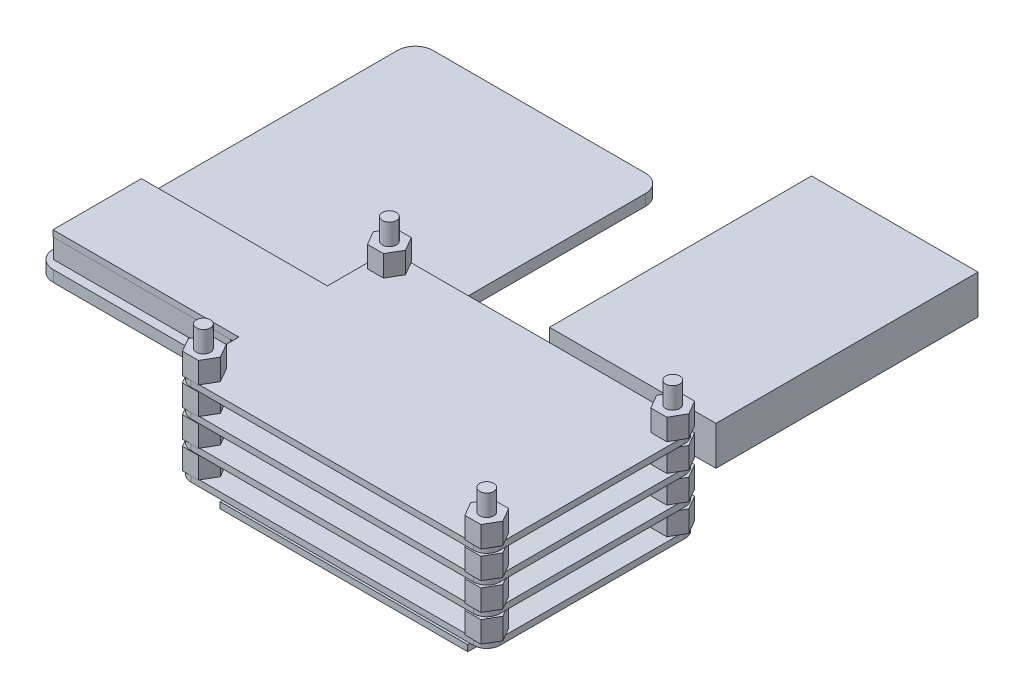
from build123d import *

# Parameters (mm, degrees)
SKETCH1_W             = 44.323
SKETCH1_H             = 30.353
SKETCH1_R             = 1.0033
BOSS_EXTRUDE1_DEPTH   = 0.889
FILLET1_R             = 1.905
BOSS_EXTRUDE2_DEPTH   = 3.048
SKETCH3_W             = 16.51
SKETCH3_H             = 2.54
BOSS_EXTRUDE3_DEPTH   = 3.048
LPATTERN4_START       = -3.937
LPATTERN4_OUTLINE_R   = 1.0033
LPATTERN4_DEPTH       = 0.889
LPATTERN4_START_2     = -3.048
LPATTERN4_2_DEPTH     = 3.048
LPATTERN4_START_3     = -6.985
LPATTERN4_3_OUTLINE_W = 16.51
LPATTERN4_3_OUTLINE_H = 2.54
LPATTERN4_3_DEPTH     = 3.048
LPATTERN5_START       = -11.811
LPATTERN5_OUTLINE_R   = 1.0033
LPATTERN5_DEPTH       = 0.889
LPATTERN5_START_2     = -7.874
LPATTERN5_2_OUTLINE_R = 1.0033
LPATTERN5_2_DEPTH     = 0.889
LPATTERN5_START_3     = -10.922
LPATTERN5_3_OUTLINE_R = 1.0033
LPATTERN5_3_OUTLINE_W = 16.51
LPATTERN5_3_OUTLINE_H = 2.54
LPATTERN5_3_DEPTH     = 6.985
LPATTERN5_START_4     = -14.859
LPATTERN5_4_OUTLINE_W = 16.51
LPATTERN5_4_OUTLINE_H = 2.54
LPATTERN5_4_DEPTH     = 3.048
LPATTERN5_5_OUTLINE_R = 1.0033
LPATTERN5_5_DEPTH     = 3.048
LPATTERN5_START_5     = -6.985
LPATTERN5_6_OUTLINE_R = 1.0033
LPATTERN5_6_DEPTH     = 3.048
SKETCH5_W             = 35.5219
SKETCH5_H             = 24.9682
SKETCH5_R             = 1.0033
BOSS_EXTRUDE4_DEPTH   = 0.889
BOSS_EXTRUDE5_REACH   = 35.239
SKETCH7_W             = 27.686
SKETCH7_H             = 18.542
BOSS_EXTRUDE6_DEPTH   = 1.27
SKETCH8_W             = 26.67
SKETCH8_H             = 12.7
BOSS_EXTRUDE7_DEPTH   = 0.889
SKETCH9_R             = 1.0033
BOSS_EXTRUDE8_DEPTH   = 3.048
SKETCH10_W            = 25.4
SKETCH10_H            = 2.54
BOSS_EXTRUDE9_DEPTH   = 2.794
BOSS_EXTRUDE10_DEPTH  = 1.6002
SKETCH13_R            = 0.635
BOSS_EXTRUDE11_DEPTH  = 2.54
SKETCH14_W            = 23.876
SKETCH14_H            = 5.588
BOSS_EXTRUDE12_DEPTH  = 37.592


# Read off the part's stored shape, not the designer's step: LPattern4, LPattern5
with BuildPart() as part:
    # Sketch1 → Boss-Extrude1 (new body)
    with BuildSketch(Plane(origin=(0, 0, 0), x_dir=(1, 0, 0), z_dir=(0, 1, 0))):
        Rectangle(SKETCH1_W, SKETCH1_H)
        with Locations(Location((-20.2565, 13.2715, 0), (0, 0, 270))):
            Circle(SKETCH1_R, mode=Mode.SUBTRACT)
        with Locations(Location((20.3835, 13.2715, 0), (0, 0, 270))):
            Circle(SKETCH1_R, mode=Mode.SUBTRACT)
        with Locations(Location((20.3835, -13.3985, 0), (0, 0, 270))):
            Circle(SKETCH1_R, mode=Mode.SUBTRACT)
        with Locations(Location((-20.2565, -13.3985, 0), (0, 0, 270))):
            Circle(SKETCH1_R, mode=Mode.SUBTRACT)
    extrude(amount=BOSS_EXTRUDE1_DEPTH)

    # Fillet1
    fillet1_edges = [part.edges().sort_by_distance(p)[0] for p in [
        (22.1615, 0.4445, 15.1765),
        (-22.1615, 0.4445, 15.1765),
        (-22.1615, 0.4445, -15.1765),
        (22.1615, 0.4445, -15.1765),
    ]]
    fillet(fillet1_edges, radius=FILLET1_R)

    # Sketch2 → Boss-Extrude2 (add)
    with BuildSketch(Plane(origin=(0, 0.889, 0), x_dir=(1, 0, 0), z_dir=(0, 1, 0))):
        Polygon((18.081142597, 13.2715), (19.232321298, 11.2776), (21.534678702, 11.2776), (22.685857403, 13.2715), (21.534678702, 15.2654), (19.232321298, 15.2654), align=None)
        Polygon((18.081142597, -13.3985), (19.232321298, -15.3924), (21.534678702, -15.3924), (22.685857403, -13.3985), (21.534678702, -11.4046), (19.232321298, -11.4046), align=None)
        Polygon((-17.954163663, -13.281349176), (-19.096802195, -11.282542833), (-21.399138532, -11.272693656), (-22.558836337, -13.261650824), (-21.416197805, -15.260457167), (-19.113861468, -15.270306344), align=None)
        Polygon((-17.954144347, 13.27433901), (-19.107780828, 15.266817989), (-21.410136481, 15.263978979), (-22.558855653, 13.26866099), (-21.405219172, 11.276182011), (-19.102863519, 11.279021021), align=None)
    extrude(amount=BOSS_EXTRUDE2_DEPTH)

    # Sketch3 → Boss-Extrude3 (add)
    with BuildSketch(Plane(origin=(0, 0, 0), x_dir=(-1, 0, 0), z_dir=(0, -1, 0))):
        with Locations((5.9563, -9.2202)):
            Rectangle(SKETCH3_W, SKETCH3_H)
    extrude(amount=BOSS_EXTRUDE3_DEPTH)

    # LPattern4 outline → LPattern4 (add)
    with BuildSketch(Plane(origin=(0, 0, 0), x_dir=(1, 0, 0), z_dir=(0, 1, 0)).offset(LPATTERN4_START)):
        with BuildLine():
            ThreePointArc((22.1615, 13.2715), (21.603538418, 14.618538418), (20.2565, 15.1765))
            Line((20.2565, 15.1765), (-20.2565, 15.1765))
            ThreePointArc((-20.2565, 15.1765), (-21.603538418, 14.618538418), (-22.1615, 13.2715))
            Line((-22.1615, 13.2715), (-22.1615, -13.2715))
            ThreePointArc((-22.1615, -13.2715), (-21.603538418, -14.618538418), (-20.2565, -15.1765))
            Line((-20.2565, -15.1765), (20.2565, -15.1765))
            ThreePointArc((20.2565, -15.1765), (21.603538418, -14.618538418), (22.1615, -13.2715))
            Line((22.1615, -13.2715), (22.1615, 13.2715))
        make_face()
        with Locations((20.3835, 13.2715)):
            Circle(LPATTERN4_OUTLINE_R, mode=Mode.SUBTRACT)
        with Locations((20.3835, -13.3985)):
            Circle(LPATTERN4_OUTLINE_R, mode=Mode.SUBTRACT)
        with Locations((-20.2565, -13.3985)):
            Circle(LPATTERN4_OUTLINE_R, mode=Mode.SUBTRACT)
        with Locations((-20.2565, 13.2715)):
            Circle(LPATTERN4_OUTLINE_R, mode=Mode.SUBTRACT)
    extrude(amount=LPATTERN4_DEPTH)

    # LPattern4 2 outline → LPattern4 2 (add)
    with BuildSketch(Plane(origin=(0, 0, 0), x_dir=(1, 0, 0), z_dir=(0, 1, 0)).offset(LPATTERN4_START_2)):
        Polygon((19.232321298, 15.2654), (18.081142597, 13.2715), (19.232321298, 11.2776), (21.534678702, 11.2776), (22.685857403, 13.2715), (21.534678702, 15.2654), align=None)
        Polygon((22.685857403, -13.3985), (21.534678702, -11.4046), (19.232321298, -11.4046), (18.081142597, -13.3985), (19.232321298, -15.3924), (21.534678702, -15.3924), align=None)
        Polygon((-17.954144347, 13.27433901), (-19.107780828, 15.266817989), (-21.410136481, 15.263978979), (-22.558855653, 13.26866099), (-21.405219172, 11.276182011), (-19.102863519, 11.279021021), align=None)
        Polygon((-19.113861468, -15.270306344), (-17.954163663, -13.281349176), (-19.096802195, -11.282542833), (-21.399138532, -11.272693656), (-22.558836337, -13.261650824), (-21.416197805, -15.260457167), align=None)
    extrude(amount=LPATTERN4_2_DEPTH)

    # LPattern4 3 outline → LPattern4 3 (add)
    with BuildSketch(Plane(origin=(0, 0, 0), x_dir=(1, 0, 0), z_dir=(0, 1, 0)).offset(LPATTERN4_START_3)):
        with Locations((-5.9563, -9.2202)):
            Rectangle(LPATTERN4_3_OUTLINE_W, LPATTERN4_3_OUTLINE_H)
    extrude(amount=LPATTERN4_3_DEPTH)

    # LPattern5 2 outline → LPattern5 2 (add)
    with BuildSketch(Plane(origin=(0, 0, 0), x_dir=(1, 0, 0), z_dir=(0, 1, 0)).offset(LPATTERN5_START_2)):
        with BuildLine():
            ThreePointArc((22.1615, 13.2715), (21.603538418, 14.618538418), (20.2565, 15.1765))
            Line((20.2565, 15.1765), (-20.2565, 15.1765))
            ThreePointArc((-20.2565, 15.1765), (-21.603538418, 14.618538418), (-22.1615, 13.2715))
            Line((-22.1615, 13.2715), (-22.1615, -13.2715))
            ThreePointArc((-22.1615, -13.2715), (-21.603538418, -14.618538418), (-20.2565, -15.1765))
            Line((-20.2565, -15.1765), (20.2565, -15.1765))
            ThreePointArc((20.2565, -15.1765), (21.603538418, -14.618538418), (22.1615, -13.2715))
            Line((22.1615, -13.2715), (22.1615, 13.2715))
        make_face()
        with Locations((20.3835, 13.2715)):
            Circle(LPATTERN5_2_OUTLINE_R, mode=Mode.SUBTRACT)
        with Locations((20.3835, -13.3985)):
            Circle(LPATTERN5_2_OUTLINE_R, mode=Mode.SUBTRACT)
        with Locations((-20.2565, -13.3985)):
            Circle(LPATTERN5_2_OUTLINE_R, mode=Mode.SUBTRACT)
        with Locations((-20.2565, 13.2715)):
            Circle(LPATTERN5_2_OUTLINE_R, mode=Mode.SUBTRACT)
    extrude(amount=LPATTERN5_2_DEPTH)



with BuildPart() as body_2:
    # LPattern5 outline → LPattern5 (new body)
    with BuildSketch(Plane(origin=(0, 0, 0), x_dir=(1, 0, 0), z_dir=(0, 1, 0)).offset(LPATTERN5_START)):
        with BuildLine():
            ThreePointArc((22.1615, 13.2715), (21.603538418, 14.618538418), (20.2565, 15.1765))
            Line((20.2565, 15.1765), (-20.2565, 15.1765))
            ThreePointArc((-20.2565, 15.1765), (-21.603538418, 14.618538418), (-22.1615, 13.2715))
            Line((-22.1615, 13.2715), (-22.1615, -13.2715))
            ThreePointArc((-22.1615, -13.2715), (-21.603538418, -14.618538418), (-20.2565, -15.1765))
            Line((-20.2565, -15.1765), (20.2565, -15.1765))
            ThreePointArc((20.2565, -15.1765), (21.603538418, -14.618538418), (22.1615, -13.2715))
            Line((22.1615, -13.2715), (22.1615, 13.2715))
        make_face()
        with Locations((20.3835, 13.2715)):
            Circle(LPATTERN5_OUTLINE_R, mode=Mode.SUBTRACT)
        with Locations((20.3835, -13.3985)):
            Circle(LPATTERN5_OUTLINE_R, mode=Mode.SUBTRACT)
        with Locations((-20.2565, -13.3985)):
            Circle(LPATTERN5_OUTLINE_R, mode=Mode.SUBTRACT)
        with Locations((-20.2565, 13.2715)):
            Circle(LPATTERN5_OUTLINE_R, mode=Mode.SUBTRACT)
    extrude(amount=LPATTERN5_DEPTH)


with BuildPart() as part_1:
    add(part.part)

    add(body_2.part)  # LPattern5 3 merges body 2
    # LPattern5 3 outline → LPattern5 3 (add)
    # profile 1 of 5: a face of its own
    with BuildSketch(Plane(origin=(0, 0, 0), x_dir=(1, 0, 0), z_dir=(0, 1, 0)).offset(LPATTERN5_START_3)):
        with BuildLine():
            Line((22.1615, 12.363286336), (22.1615, 13.2715))
            ThreePointArc((22.1615, 13.2715), (21.603538418, 14.618538418), (20.2565, 15.1765))
            Line((20.2565, 15.1765), (19.180994859, 15.1765))
            Line((19.180994859, 15.1765), (18.081142597, 13.2715))
            Line((18.081142597, 13.2715), (19.232321298, 11.2776))
            Line((19.232321298, 11.2776), (21.534678702, 11.2776))
            Line((21.534678702, 11.2776), (22.1615, 12.363286336))
        make_face()
        with Locations((20.3835, 13.2715)):
            Circle(LPATTERN5_3_OUTLINE_R, mode=Mode.SUBTRACT)
    # profile 2 of 5: a face of its own
    with BuildSketch(Plane(origin=(0, 0, 0), x_dir=(1, 0, 0), z_dir=(0, 1, 0)).offset(LPATTERN5_START_3)):
        with BuildLine():
            Line((22.1615, -13.2715), (22.1615, -12.490286336))
            Line((22.1615, -12.490286336), (21.534678702, -11.4046))
            Line((21.534678702, -11.4046), (19.232321298, -11.4046))
            Line((19.232321298, -11.4046), (18.081142597, -13.3985))
            Line((18.081142597, -13.3985), (19.107671375, -15.1765))
            Line((19.107671375, -15.1765), (20.2565, -15.1765))
            ThreePointArc((20.2565, -15.1765), (21.603538418, -14.618538418), (22.1615, -13.2715))
        make_face()
        with Locations((20.3835, -13.3985)):
            Circle(LPATTERN5_3_OUTLINE_R, mode=Mode.SUBTRACT)
    # profile 3 of 5: a face of its own
    with BuildSketch(Plane(origin=(0, 0, 0), x_dir=(1, 0, 0), z_dir=(0, 1, 0)).offset(LPATTERN5_START_3)):
        with BuildLine():
            Line((-17.954144347, 13.27433901), (-19.055487113, 15.1765))
            Line((-19.055487113, 15.1765), (-20.2565, 15.1765))
            ThreePointArc((-20.2565, 15.1765), (-21.603538418, 14.618538418), (-22.1615, 13.2715))
            Line((-22.1615, 13.2715), (-22.1615, 12.582376533))
            Line((-22.1615, 12.582376533), (-21.405219172, 11.276182011))
            Line((-21.405219172, 11.276182011), (-19.102863519, 11.279021021))
            Line((-19.102863519, 11.279021021), (-17.954144347, 13.27433901))
        make_face()
        with Locations((-20.2565, 13.2715)):
            Circle(LPATTERN5_3_OUTLINE_R, mode=Mode.SUBTRACT)
    # profile 4 of 5: a face of its own
    with BuildSketch(Plane(origin=(0, 0, 0), x_dir=(1, 0, 0), z_dir=(0, 1, 0)).offset(LPATTERN5_START_3)):
        with BuildLine():
            Line((-20.2565, -15.1765), (-19.059165966, -15.1765))
            Line((-19.059165966, -15.1765), (-17.954163663, -13.281349176))
            Line((-17.954163663, -13.281349176), (-19.096802195, -11.282542833))
            Line((-19.096802195, -11.282542833), (-21.399138532, -11.272693656))
            Line((-21.399138532, -11.272693656), (-22.1615, -12.580193161))
            Line((-22.1615, -12.580193161), (-22.1615, -13.2715))
            ThreePointArc((-22.1615, -13.2715), (-21.603538418, -14.618538418), (-20.2565, -15.1765))
        make_face()
        with Locations((-20.2565, -13.3985)):
            Circle(LPATTERN5_3_OUTLINE_R, mode=Mode.SUBTRACT)
    # profile 5 of 5: a face of its own
    with BuildSketch(Plane(origin=(0, 0, 0), x_dir=(1, 0, 0), z_dir=(0, 1, 0)).offset(LPATTERN5_START_3)):
        with Locations((-5.9563, -9.2202)):
            Rectangle(LPATTERN5_3_OUTLINE_W, LPATTERN5_3_OUTLINE_H)
    extrude(amount=LPATTERN5_3_DEPTH)

    # LPattern5 4 outline → LPattern5 4 (add)
    with BuildSketch(Plane(origin=(0, 0, 0), x_dir=(1, 0, 0), z_dir=(0, 1, 0)).offset(LPATTERN5_START_4)):
        with Locations((-5.9563, -9.2202)):
            Rectangle(LPATTERN5_4_OUTLINE_W, LPATTERN5_4_OUTLINE_H)
    extrude(amount=LPATTERN5_4_DEPTH)

    # LPattern5 5 outline → LPattern5 5 (add)
    with BuildSketch(Plane(origin=(0, 0, 0), x_dir=(1, 0, 0), z_dir=(0, 1, 0)).offset(LPATTERN5_START_3)):
        with BuildLine():
            ThreePointArc((20.2565, 15.1765), (21.603538418, 14.618538418), (22.1615, 13.2715))
            Line((22.1615, 13.2715), (22.1615, 12.363286336))
            Line((22.1615, 12.363286336), (22.685857403, 13.2715))
            Line((22.685857403, 13.2715), (21.534678702, 15.2654))
            Line((21.534678702, 15.2654), (19.232321298, 15.2654))
            Line((19.232321298, 15.2654), (19.180994859, 15.1765))
            Line((19.180994859, 15.1765), (20.2565, 15.1765))
        make_face()
        with BuildLine():
            Line((22.685857403, -13.3985), (22.1615, -12.490286336))
            Line((22.1615, -12.490286336), (22.1615, -13.2715))
            ThreePointArc((22.1615, -13.2715), (21.603538418, -14.618538418), (20.2565, -15.1765))
            Line((20.2565, -15.1765), (19.107671375, -15.1765))
            Line((19.107671375, -15.1765), (19.232321298, -15.3924))
            Line((19.232321298, -15.3924), (21.534678702, -15.3924))
            Line((21.534678702, -15.3924), (22.685857403, -13.3985))
        make_face()
        with BuildLine():
            Line((-20.2565, 15.1765), (-19.055487113, 15.1765))
            Line((-19.055487113, 15.1765), (-19.107780828, 15.266817989))
            Line((-19.107780828, 15.266817989), (-21.410136481, 15.263978979))
            Line((-21.410136481, 15.263978979), (-22.558855653, 13.26866099))
            Line((-22.558855653, 13.26866099), (-22.1615, 12.582376533))
            Line((-22.1615, 12.582376533), (-22.1615, 13.2715))
            ThreePointArc((-22.1615, 13.2715), (-21.603538418, 14.618538418), (-20.2565, 15.1765))
        make_face()
        with BuildLine():
            Line((-19.113861468, -15.270306344), (-19.059165966, -15.1765))
            Line((-19.059165966, -15.1765), (-20.2565, -15.1765))
            ThreePointArc((-20.2565, -15.1765), (-21.603538418, -14.618538418), (-22.1615, -13.2715))
            Line((-22.1615, -13.2715), (-22.1615, -12.580193161))
            Line((-22.1615, -12.580193161), (-22.558836337, -13.261650824))
            Line((-22.558836337, -13.261650824), (-21.416197805, -15.260457167))
            Line((-21.416197805, -15.260457167), (-19.113861468, -15.270306344))
        make_face()
        with Locations((-20.2565, 13.2715)):
            Circle(LPATTERN5_5_OUTLINE_R)
        with Locations((20.3835, 13.2715)):
            Circle(LPATTERN5_5_OUTLINE_R)
        with Locations((20.3835, -13.3985)):
            Circle(LPATTERN5_5_OUTLINE_R)
        with Locations((-20.2565, -13.3985)):
            Circle(LPATTERN5_5_OUTLINE_R)
    extrude(amount=LPATTERN5_5_DEPTH)

    # LPattern5 6 outline → LPattern5 6 (add)
    with BuildSketch(Plane(origin=(0, 0, 0), x_dir=(1, 0, 0), z_dir=(0, 1, 0)).offset(LPATTERN5_START_5)):
        with BuildLine():
            ThreePointArc((20.2565, 15.1765), (21.603538418, 14.618538418), (22.1615, 13.2715))
            Line((22.1615, 13.2715), (22.1615, 12.363286336))
            Line((22.1615, 12.363286336), (22.685857403, 13.2715))
            Line((22.685857403, 13.2715), (21.534678702, 15.2654))
            Line((21.534678702, 15.2654), (19.232321298, 15.2654))
            Line((19.232321298, 15.2654), (19.180994859, 15.1765))
            Line((19.180994859, 15.1765), (20.2565, 15.1765))
        make_face()
        with BuildLine():
            Line((22.685857403, -13.3985), (22.1615, -12.490286336))
            Line((22.1615, -12.490286336), (22.1615, -13.2715))
            ThreePointArc((22.1615, -13.2715), (21.603538418, -14.618538418), (20.2565, -15.1765))
            Line((20.2565, -15.1765), (19.107671375, -15.1765))
            Line((19.107671375, -15.1765), (19.232321298, -15.3924))
            Line((19.232321298, -15.3924), (21.534678702, -15.3924))
            Line((21.534678702, -15.3924), (22.685857403, -13.3985))
        make_face()
        with BuildLine():
            Line((-20.2565, 15.1765), (-19.055487113, 15.1765))
            Line((-19.055487113, 15.1765), (-19.107780828, 15.266817989))
            Line((-19.107780828, 15.266817989), (-21.410136481, 15.263978979))
            Line((-21.410136481, 15.263978979), (-22.558855653, 13.26866099))
            Line((-22.558855653, 13.26866099), (-22.1615, 12.582376533))
            Line((-22.1615, 12.582376533), (-22.1615, 13.2715))
            ThreePointArc((-22.1615, 13.2715), (-21.603538418, 14.618538418), (-20.2565, 15.1765))
        make_face()
        with BuildLine():
            Line((-19.113861468, -15.270306344), (-19.059165966, -15.1765))
            Line((-19.059165966, -15.1765), (-20.2565, -15.1765))
            ThreePointArc((-20.2565, -15.1765), (-21.603538418, -14.618538418), (-22.1615, -13.2715))
            Line((-22.1615, -13.2715), (-22.1615, -12.580193161))
            Line((-22.1615, -12.580193161), (-22.558836337, -13.261650824))
            Line((-22.558836337, -13.261650824), (-21.416197805, -15.260457167))
            Line((-21.416197805, -15.260457167), (-19.113861468, -15.270306344))
        make_face()
        with Locations((-20.2565, 13.2715)):
            Circle(LPATTERN5_6_OUTLINE_R)
        with Locations((20.3835, 13.2715)):
            Circle(LPATTERN5_6_OUTLINE_R)
        with Locations((20.3835, -13.3985)):
            Circle(LPATTERN5_6_OUTLINE_R)
        with Locations((-20.2565, -13.3985)):
            Circle(LPATTERN5_6_OUTLINE_R)
    extrude(amount=LPATTERN5_6_DEPTH)

    # Sketch5 → Boss-Extrude4 (add)
    with BuildSketch(Plane.XZ.offset(14.859)):
        with Locations((-1.04775, -0.0254)):
            Rectangle(SKETCH5_W, SKETCH5_H)
        with Locations(Location((-16.335216988, 9.2202, 0), (0, 0, 270))):
            Circle(SKETCH5_R, mode=Mode.SUBTRACT)
        with Locations(Location((12.1666, -11.4173, 0), (0, 0, 270))):
            Circle(SKETCH5_R, mode=Mode.SUBTRACT)
    extrude(amount=BOSS_EXTRUDE4_DEPTH)

    # Sketch6 → Boss-Extrude5 (add, up to next)
    with BuildSketch(Plane(origin=(0, -14.859, 0), x_dir=(1, 0, 0), z_dir=(0, 1, 0)), mode=Mode.PRIVATE) as boss_extrude5_sk1:
        Polygon((12.1666, 9.114942597), (14.1605, 10.266121298), (14.1605, 12.568478702), (12.1666, 13.719657403), (10.1727, 12.568478702), (10.1727, 10.266121298), align=None)
    boss_extrude5_tool1 = extrude(boss_extrude5_sk1.sketch, amount=BOSS_EXTRUDE5_REACH, mode=Mode.PRIVATE) - part_1.part
    # Sketch6 → Boss-Extrude5 (add, up to next)
    with BuildSketch(Plane(origin=(0, -14.859, 0), x_dir=(1, 0, 0), z_dir=(0, 1, 0)), mode=Mode.PRIVATE) as boss_extrude5_sk2:
        Polygon((-16.335216988, -11.522557403), (-14.341316988, -10.371378702), (-14.341316988, -8.069021298), (-16.335216988, -6.917842597), (-18.329116988, -8.069021298), (-18.329116988, -10.371378702), align=None)
    boss_extrude5_tool2 = extrude(boss_extrude5_sk2.sketch, amount=BOSS_EXTRUDE5_REACH, mode=Mode.PRIVATE) - part_1.part
    add(boss_extrude5_tool1.solids().sort_by_distance((12.1666, -14.859, -11.4173))[0])
    add(boss_extrude5_tool2.solids().sort_by_distance((-16.335217, -14.859, 9.2202))[0])

    # Sketch7 → Boss-Extrude6 (add)
    with BuildSketch(Plane.XZ.offset(15.748)):
        with Locations((-4.5212, -2.794)):
            Rectangle(SKETCH7_W, SKETCH7_H)
    extrude(amount=BOSS_EXTRUDE6_DEPTH)

    # Sketch8 → Boss-Extrude7 (add)
    with BuildSketch(Plane.XZ):
        with Locations((-35.4965, 0.0635)):
            Rectangle(SKETCH8_W, SKETCH8_H)
    extrude(amount=-BOSS_EXTRUDE7_DEPTH)

    # Sketch9 → Boss-Extrude8 (add)
    with BuildSketch(Plane(origin=(0, 3.937, 0), x_dir=(1, 0, 0), z_dir=(0, 1, 0))):
        with Locations(Location((20.3835, -13.3985, 0), (0, 0, 270))):
            Circle(SKETCH9_R)
        with Locations(Location((-20.2565, -13.3985, 0), (0, 0, 270))):
            Circle(SKETCH9_R)
        with Locations(Location((-20.2565, 13.2715, 0), (0, 0, 270))):
            Circle(SKETCH9_R)
        with Locations(Location((20.3835, 13.2715, 0), (0, 0, 270))):
            Circle(SKETCH9_R)
    extrude(amount=BOSS_EXTRUDE8_DEPTH)

    # Sketch10 → Boss-Extrude9 (add)
    with BuildSketch(Plane.XZ):
        with Locations((-36.1061, 5.1181)):
            Rectangle(SKETCH10_W, SKETCH10_H)
        with Locations((-36.1061, -4.9911)):
            Rectangle(SKETCH10_W, SKETCH10_H)
    extrude(amount=BOSS_EXTRUDE9_DEPTH)

    # Sketch11 → Boss-Extrude10 (add)
    with BuildSketch(Plane.XZ.offset(2.794)):
        with BuildLine():
            Line((-22.6695, 5.1181), (-22.6695, -13.1445))
            ThreePointArc((-22.6695, -13.1445), (-21.925551224, -14.940551224), (-20.1295, -15.6845))
            Line((-20.1295, -15.6845), (-17.0561, -15.6845))
            ThreePointArc((-17.0561, -15.6845), (-15.260048776, -16.428448776), (-14.5161, -18.2245))
            Line((-14.5161, -18.2245), (-14.5161, -44.2595))
            ThreePointArc((-14.5161, -44.2595), (-15.260048776, -46.055551224), (-17.0561, -46.7995))
            Line((-17.0561, -46.7995), (-47.5361, -46.7995))
            ThreePointArc((-47.5361, -46.7995), (-49.332151224, -46.055551224), (-50.0761, -44.2595))
            Line((-50.0761, -44.2595), (-50.0761, 5.1181))
            ThreePointArc((-50.0761, 5.1181), (-49.332151224, 6.914151224), (-47.5361, 7.6581))
            Line((-47.5361, 7.6581), (-25.2095, 7.6581))
            ThreePointArc((-25.2095, 7.6581), (-23.413448776, 6.914151224), (-22.6695, 5.1181))
        make_face()
    extrude(amount=BOSS_EXTRUDE10_DEPTH)

    # Sketch13 → Boss-Extrude11 (add)
    with BuildSketch(Plane(origin=(0, 0, -15.1765), x_dir=(-1, 0, 0), z_dir=(0, 0, -1))):
        with Locations(Location((-8.675892038, -2.54, 0), (0, 0, 233.130102354))):
            Circle(SKETCH13_R)
        with Locations(Location((-11.723892038, -2.54, 0), (0, 0, 233.130102354))):
            Circle(SKETCH13_R)
    extrude(amount=BOSS_EXTRUDE11_DEPTH)

    # Sketch14 → Boss-Extrude12 (add)
    with BuildSketch(Plane(origin=(0, 0, -17.7165), x_dir=(-1, 0, 0), z_dir=(0, 0, -1))):
        with Locations((-10.199892038, -2.54)):
            Rectangle(SKETCH14_W, SKETCH14_H)
    extrude(amount=BOSS_EXTRUDE12_DEPTH)


solid = part_1.part
